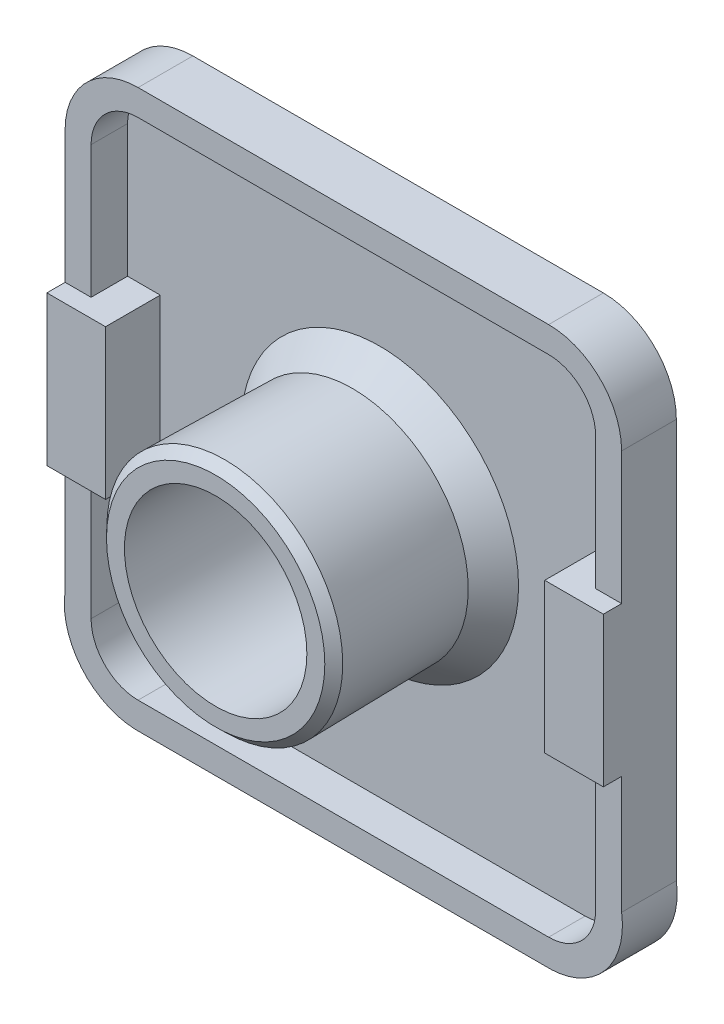
from build123d import *

# Parameters (mm, degrees)
EXTRUDE_1_DEPTH     = 1
EXTRUDE_2_DEPTH     = 3
SKETCH_1_4_R        = 6.3
EXTRUDE_3_DEPTH     = 10
EXTRUDE_3_DRAFT     = -1
SKETCH_1_5_W        = 1.42302488
SKETCH_1_5_H        = 8.2
SKETCH_1_5_W_2      = 1.791144373
EXTRUDE_4_DEPTH     = 4
CHAMFER_1_SIZE      = 0.5
CHAMFER_1_SIZE2     = 0.491497051
SKETCH_2_R          = 5
CUT_EXTRUDE_1_DEPTH = 9
CHAMFER_2_SIZE      = 1.5
CHAMFER_2_SIZE_2    = 1.284636358
CHAMFER_2_SIZE_3    = 1.303930107


# Read off the part's stored shape, not the designer's step: Бобышка-Вытянуть1
with BuildPart() as part:
    # Бобышка-Вытянуть1 outline → Бобышка-Вытянуть1 (new body)
    with BuildSketch(Plane.XY):
        with BuildLine():
            Line((-15.25, 11.25), (-15.25, -10.65))
            ThreePointArc((-15.25, -10.65), (-14.365417418, -13.829568629), (-11.406655615, -15.291714861))
            Line((-11.406655615, -15.291714861), (11.406655615, -15.291714861))
            ThreePointArc((11.406655615, -15.291714861), (14.365417418, -13.829568629), (15.25, -10.65))
            Line((15.25, -10.65), (15.25, 11.25))
            ThreePointArc((15.25, 11.25), (14.078427125, 14.078427125), (11.25, 15.25))
            Line((11.25, 15.25), (-11.25, 15.25))
            ThreePointArc((-11.25, 15.25), (-14.078427125, 14.078427125), (-15.25, 11.25))
        make_face()
    extrude(amount=EXTRUDE_1_DEPTH)

    # Эскиз1<3> → Бобышка-Вытянуть2 (add)
    with BuildSketch(Plane.XY):
        with BuildLine():
            ThreePointArc((-11.25, 15.25), (-14.078427125, 14.078427125), (-15.25, 11.25))
            Line((-15.25, 11.25), (-15.25, -10.65))
            ThreePointArc((-15.25, -10.65), (-14.365417418, -13.829568629), (-11.406655615, -15.291714861))
            Line((-11.406655615, -15.291714861), (11.406655615, -15.291714861))
            ThreePointArc((11.406655615, -15.291714861), (14.365417418, -13.829568629), (15.25, -10.65))
            Line((15.25, -10.65), (15.25, 11.25))
            ThreePointArc((15.25, 11.25), (14.078427125, 14.078427125), (11.25, 15.25))
            Line((11.25, 15.25), (-11.25, 15.25))
        make_face()
        with BuildLine():
            ThreePointArc((13.82697512, -11.25), (13.072196582, -13.072196582), (11.25, -13.82697512))
            Line((11.25, -13.82697512), (-11.25, -13.82697512))
            ThreePointArc((-11.25, -13.82697512), (-13.072196582, -13.072196582), (-13.82697512, -11.25))
            Line((-13.82697512, -11.25), (-13.82697512, -4.195156857))
            Line((-13.82697512, -4.195156857), (-12.035830747, -4.195156857))
            Line((-12.035830747, -4.195156857), (-12.035830747, 4.004843143))
            Line((-12.035830747, 4.004843143), (-13.82697512, 4.004843143))
            Line((-13.82697512, 4.004843143), (-13.82697512, 11.25))
            ThreePointArc((-13.82697512, 11.25), (-13.072196582, 13.072196582), (-11.25, 13.82697512))
            Line((-11.25, 13.82697512), (11.25, 13.82697512))
            ThreePointArc((11.25, 13.82697512), (13.072196582, 13.072196582), (13.82697512, 11.25))
            Line((13.82697512, 11.25), (13.82697512, 4.004843143))
            Line((13.82697512, 4.004843143), (12.035830747, 4.004843143))
            Line((12.035830747, 4.004843143), (12.035830747, -4.195156857))
            Line((12.035830747, -4.195156857), (13.82697512, -4.195156857))
            Line((13.82697512, -4.195156857), (13.82697512, -11.25))
        make_face(mode=Mode.SUBTRACT)
    extrude(amount=EXTRUDE_2_DEPTH)


with BuildPart() as extrude_3_tool:
    # Эскиз1<4> → Бобышка-Вытянуть3 (with draft: the straight prism first)
    with BuildSketch(Plane.XY):
        Circle(SKETCH_1_4_R)
    extrude(amount=EXTRUDE_3_DEPTH)
    # Бобышка-Вытянуть3: the draft: its side faces are tilted about the plane it starts from
    extrude_3_sides = [extrude_3_tool.faces().sort_by_distance(p)[0] for p in [
        (-6.3, 0, 5),
    ]]
    draft(extrude_3_sides, Plane.XY, EXTRUDE_3_DRAFT)


with BuildPart() as part_1:
    add(part.part)

    # Бобышка-Вытянуть3: add extrude_3_tool
    add(extrude_3_tool.part)

    # Эскиз1<5> → Бобышка-Вытянуть4 (add)
    with BuildSketch(Plane.XY):
        with Locations((-14.53848756, -0.095156857)):
            Rectangle(SKETCH_1_5_W, SKETCH_1_5_H)
        with Locations((-12.931402933, -0.095156857)):
            Rectangle(SKETCH_1_5_W_2, SKETCH_1_5_H)
        with Locations((12.931402933, -0.095156857)):
            Rectangle(SKETCH_1_5_W_2, SKETCH_1_5_H)
        with Locations((14.53848756, -0.095156857)):
            Rectangle(SKETCH_1_5_W, SKETCH_1_5_H)
    extrude(amount=EXTRUDE_4_DEPTH)

    # Фаска1
    chamfer_1_edges = [part_1.edges().sort_by_distance(p)[0] for p in [
        (-6.474550649, 0, 10),
    ]]
    chamfer_1_side = [part_1.faces().sort_by_distance(p)[0] for p in [
        (-6.396002857, 0, 5.5),
    ]]
    chamfer(chamfer_1_edges, length=CHAMFER_1_SIZE, length2=CHAMFER_1_SIZE2, reference=chamfer_1_side[0])

    # Эскиз2 → Вырез-Вытянуть1 (cut)
    with BuildSketch(Plane.XY.offset(10)):
        Circle(SKETCH_2_R)
    extrude(amount=-CUT_EXTRUDE_1_DEPTH, mode=Mode.SUBTRACT)

    # Фаска2
    # the kernel refuses this chamfer: 1.5, 1.303930107, 1.284636358 mm, written as the material it adds along each edge
    with BuildSketch(Plane(origin=(0, 0, 1), x_dir=(1, 0, 0), z_dir=(0, 1, 0))) as chamfer_2_piece_1:
        Polygon((6.317455065 + CHAMFER_2_SIZE * 0.0174524064373, -CHAMFER_2_SIZE * 0.999847695156), (6.317455065 + CHAMFER_2_SIZE_2, 0), (6.317455065, 0), align=None)
    revolve(axis=Axis((0, 0, 1), (0, 0, -1)))
    with BuildSketch(Plane(origin=(0, 0, 1), x_dir=(1, 0, 0), z_dir=(0, -1, 0))) as chamfer_2_piece_2:
        Polygon((5, CHAMFER_2_SIZE), (5 - CHAMFER_2_SIZE_3, 0), (5, 0), align=None)
    revolve(axis=Axis((0, 0, 1), (0, 0, 1)))


solid = part_1.part
